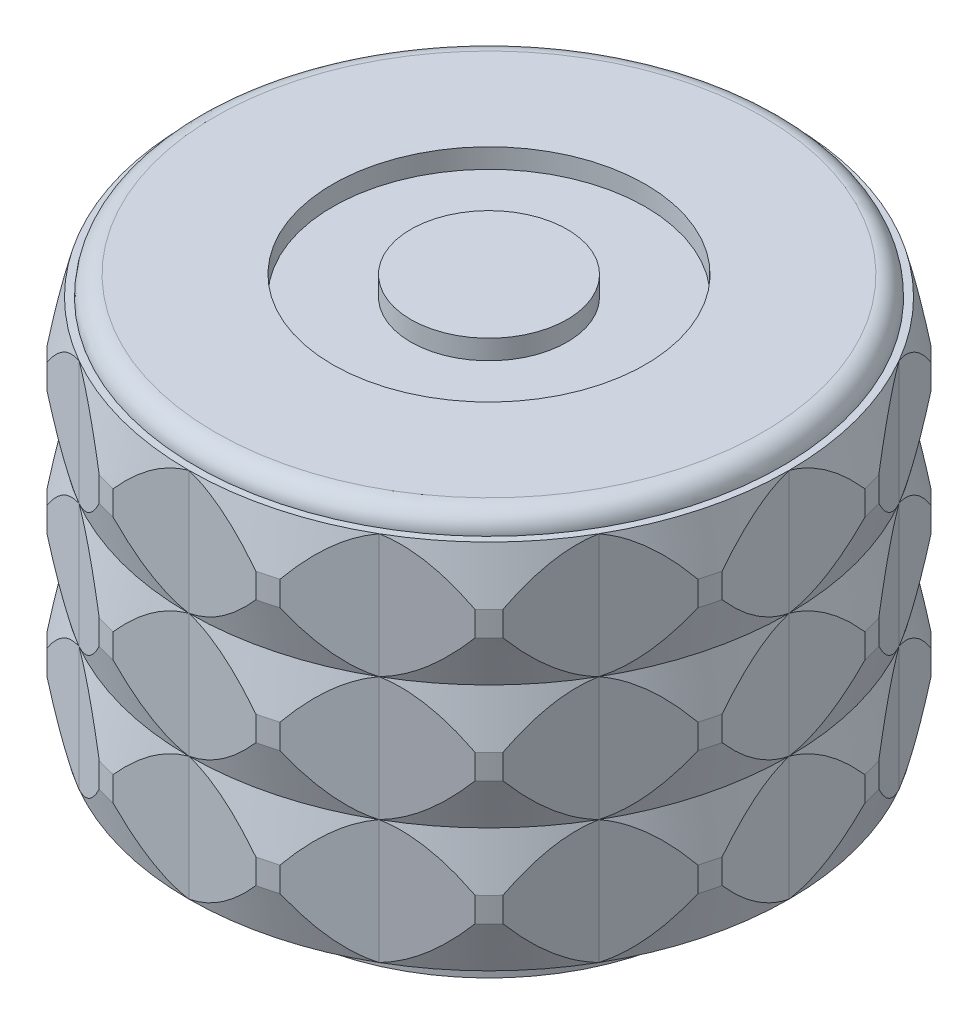
from build123d import *

# Parameters (mm, degrees)
BOSS_EXTRUDE1_START          = -10
BOSS_EXTRUDE1_DEPTH          = 10
BOSS_EXTRUDE1_2_OUTLINE_R    = 5.5
BOSS_EXTRUDE1_2_DEPTH        = 1.7
SKETCH2_R                    = 4.5
BOSS_EXTRUDE2_DEPTH          = 0.3
F_8_0_8_DIAMETER_HOLE1_D     = 8
F_8_0_8_DIAMETER_HOLE1_DEPTH = 0.5
SKETCH5_W                    = 2
SKETCH5_H                    = 0.5
M3_5_CLEARANCE_HOLE1_D       = 4.134
M3_5_CLEARANCE_HOLE1_DEPTH   = 6
M3_5_CLEARANCE_HOLE1_TIP     = 1.193383006
CHAMFER1_SIZE                = 0.433


with BuildPart() as part:
    # Boss-Extrude1: read off the stored shape, not the designer's step
    # Boss-Extrude1 outline → Boss-Extrude1 (new body)
    with BuildSketch(Plane.XZ.offset(-2).offset(BOSS_EXTRUDE1_START)):
        with BuildLine():
            Line((6.651075101, 3.84), (5.832425317, 5.475656574))
            ThreePointArc((5.832425317, 5.475656574), (5.656854249, 5.656854249), (5.475656574, 5.832425317))
            Line((5.475656574, 5.832425317), (3.84, 6.651075101))
            Line((3.84, 6.651075101), (2.313200203, 7.658270354))
            ThreePointArc((2.313200203, 7.658270354), (2.070552361, 7.72740661), (1.825845037, 7.788856778))
            Line((1.825845037, 7.788856778), (0, 7.68))
            Line((0, 7.68), (-1.825845037, 7.788856778))
            ThreePointArc((-1.825845037, 7.788856778), (-2.070552361, 7.72740661), (-2.313200203, 7.658270354))
            Line((-2.313200203, 7.658270354), (-3.84, 6.651075101))
            Line((-3.84, 6.651075101), (-5.475656574, 5.832425317))
            ThreePointArc((-5.475656574, 5.832425317), (-5.656854249, 5.656854249), (-5.832425317, 5.475656574))
            Line((-5.832425317, 5.475656574), (-6.651075101, 3.84))
            Line((-6.651075101, 3.84), (-7.658270354, 2.313200203))
            ThreePointArc((-7.658270354, 2.313200203), (-7.72740661, 2.070552361), (-7.788856778, 1.825845037))
            Line((-7.788856778, 1.825845037), (-7.68, 0))
            Line((-7.68, 0), (-7.788856778, -1.825845037))
            ThreePointArc((-7.788856778, -1.825845037), (-7.72740661, -2.070552361), (-7.658270354, -2.313200203))
            Line((-7.658270354, -2.313200203), (-6.651075101, -3.84))
            Line((-6.651075101, -3.84), (-5.832425317, -5.475656574))
            ThreePointArc((-5.832425317, -5.475656574), (-5.656854249, -5.656854249), (-5.475656574, -5.832425317))
            Line((-5.475656574, -5.832425317), (-3.84, -6.651075101))
            Line((-3.84, -6.651075101), (-2.313200203, -7.658270354))
            ThreePointArc((-2.313200203, -7.658270354), (-2.070552361, -7.72740661), (-1.825845037, -7.788856778))
            Line((-1.825845037, -7.788856778), (0, -7.68))
            Line((0, -7.68), (1.825845037, -7.788856778))
            ThreePointArc((1.825845037, -7.788856778), (2.070552361, -7.72740661), (2.313200203, -7.658270354))
            Line((2.313200203, -7.658270354), (3.84, -6.651075101))
            Line((3.84, -6.651075101), (5.475656574, -5.832425317))
            ThreePointArc((5.475656574, -5.832425317), (5.656854249, -5.656854249), (5.832425317, -5.475656574))
            Line((5.832425317, -5.475656574), (6.651075101, -3.84))
            Line((6.651075101, -3.84), (7.658270354, -2.313200203))
            ThreePointArc((7.658270354, -2.313200203), (7.72740661, -2.070552361), (7.788856778, -1.825845037))
            Line((7.788856778, -1.825845037), (7.68, 0))
            Line((7.68, 0), (7.788856778, 1.825845037))
            ThreePointArc((7.788856778, 1.825845037), (7.72740661, 2.070552361), (7.658270354, 2.313200203))
            Line((7.658270354, 2.313200203), (6.651075101, 3.84))
        make_face()
    extrude(amount=BOSS_EXTRUDE1_DEPTH)

    # Boss-Extrude1 2 outline → Boss-Extrude1 2 (add)
    with BuildSketch(Plane.XZ.offset(-2)):
        Circle(BOSS_EXTRUDE1_2_OUTLINE_R)
    extrude(amount=BOSS_EXTRUDE1_2_DEPTH)

    # Boss-Extrude1 3 outline → Boss-Extrude1 3 (revolve, cut)
    with BuildSketch(Plane.XY):
        with BuildLine():
            Line((7.5, 11.5), (7.68, 11.5))
            Line((7.68, 11.5), (8, 10.233333333))
            Line((8, 10.233333333), (8, 12))
            Line((8, 12), (7, 12))
            ThreePointArc((7, 12), (7.353553391, 11.853553391), (7.5, 11.5))
        make_face()
        Polygon((8, 7.066666667), (8, 9.6), (7.68, 8.333333333), align=None)
        Polygon((8, 3.9), (8, 6.433333333), (7.68, 5.166666667), align=None)
        Polygon((8, 3.266666667), (7.68, 2), (8, 2), align=None)
    revolve(axis=Axis((0, 0, 0), (0, 1, 0)), mode=Mode.SUBTRACT)

    # Sketch2 → Boss-Extrude2 (add)
    with BuildSketch(Plane.XZ.offset(-0.3)):
        with Locations(Location((0, 0, 0), (0, 0, 270))):
            Circle(SKETCH2_R)
    extrude(amount=BOSS_EXTRUDE2_DEPTH)

    # Ø8.0 (8) Diameter Hole1
    with Locations(Plane(origin=(0, 12, 0), x_dir=(1, 0, 0), z_dir=(0, 1, 0))):
        with Locations((0, 0)):
            Hole(F_8_0_8_DIAMETER_HOLE1_D / 2, depth=F_8_0_8_DIAMETER_HOLE1_DEPTH)

    # Sketch5 → Revolve1 (revolve)
    with BuildSketch(Plane(origin=(0, 0, 0), x_dir=(-1, 0, 0), z_dir=(0, 0, -1)), mode=Mode.PRIVATE) as revolve1_sk:
        with Locations((-1, 11.75)):
            Rectangle(SKETCH5_W, SKETCH5_H)
    revolve(revolve1_sk.sketch.rotate(Axis((0, 11.5, 0), (0, 1, 0)), 270), axis=Axis((0, 11.5, 0), (0, 1, 0)))

    # M3.5 Clearance Hole1
    with Locations(Plane(origin=(0, 0, 0), x_dir=(-1, 0, 0), z_dir=(0, -1, 0))):
        with Locations((0, 0)):
            Hole(M3_5_CLEARANCE_HOLE1_D / 2, depth=M3_5_CLEARANCE_HOLE1_DEPTH)
            with Locations((0, 0, -(M3_5_CLEARANCE_HOLE1_DEPTH + M3_5_CLEARANCE_HOLE1_TIP / 2))):  # 120° drill point
                Cone(0, M3_5_CLEARANCE_HOLE1_D / 2, M3_5_CLEARANCE_HOLE1_TIP, mode=Mode.SUBTRACT)

    # Chamfer1
    chamfer1_edges = [part.edges().sort_by_distance(p)[0] for p in [
        (-2.067, 0, 0),
    ]]
    chamfer(chamfer1_edges, length=CHAMFER1_SIZE)


solid = part.part
